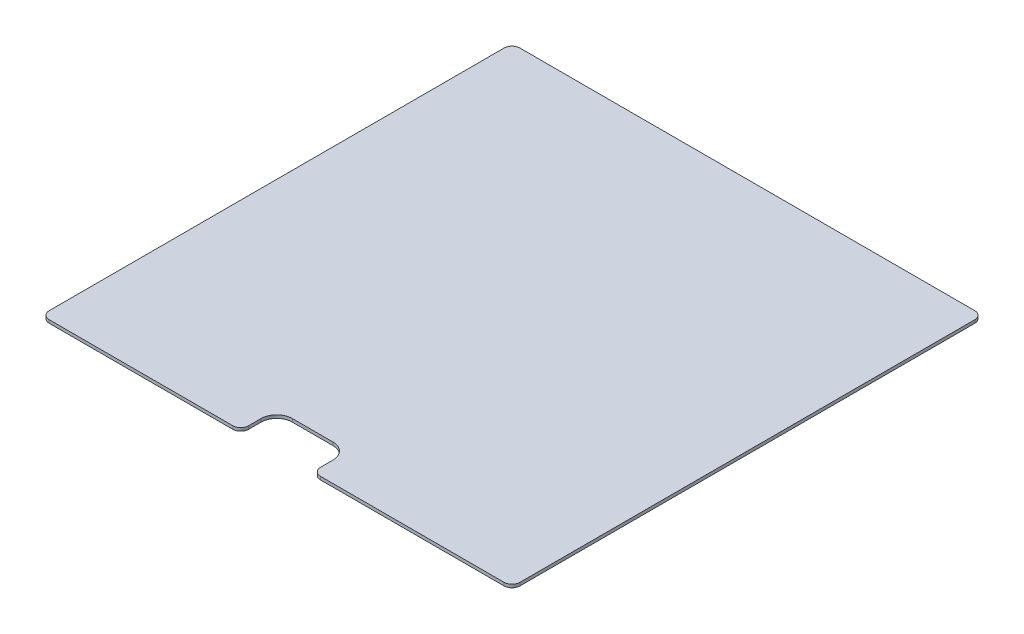
from build123d import *

# Parameters (mm, degrees)
BOSS_EXTRUDE1_DEPTH = 0.1


with BuildPart() as part:
    # Sketch1 → Boss-Extrude1 (new, symmetric)
    with BuildSketch(Plane(origin=(0, 0, 0), x_dir=(1, 0, 0), z_dir=(0, 1, 0))):
        with BuildLine():
            Line((2.2929, -14.5), (2.2929, -13.7071))
            ThreePointArc((2.2929, -13.7071), (2.000006781, -12.999993219), (1.2929, -12.7071))
            Line((1.2929, -12.7071), (-1.2929, -12.7071))
            ThreePointArc((-1.2929, -12.7071), (-2.000006781, -12.999993219), (-2.2929, -13.7071))
            Line((-2.2929, -13.7071), (-2.2929, -14.5))
            ThreePointArc((-2.2929, -14.5), (-2.439346609, -14.853553391), (-2.7929, -15))
            Line((-2.7929, -15), (-14.5, -15))
            ThreePointArc((-14.5, -15), (-14.853553391, -14.853553391), (-15, -14.5))
            Line((-15, -14.5), (-15, 14.5))
            ThreePointArc((-15, 14.5), (-14.853553391, 14.853553391), (-14.5, 15))
            Line((-14.5, 15), (14.5, 15))
            ThreePointArc((14.5, 15), (14.853553391, 14.853553391), (15, 14.5))
            Line((15, 14.5), (15, -14.5))
            ThreePointArc((15, -14.5), (14.853553391, -14.853553391), (14.5, -15))
            Line((14.5, -15), (2.7929, -15))
            ThreePointArc((2.7929, -15), (2.439346609, -14.853553391), (2.2929, -14.5))
        make_face()
    extrude(amount=BOSS_EXTRUDE1_DEPTH, both=True)


solid = part.part
